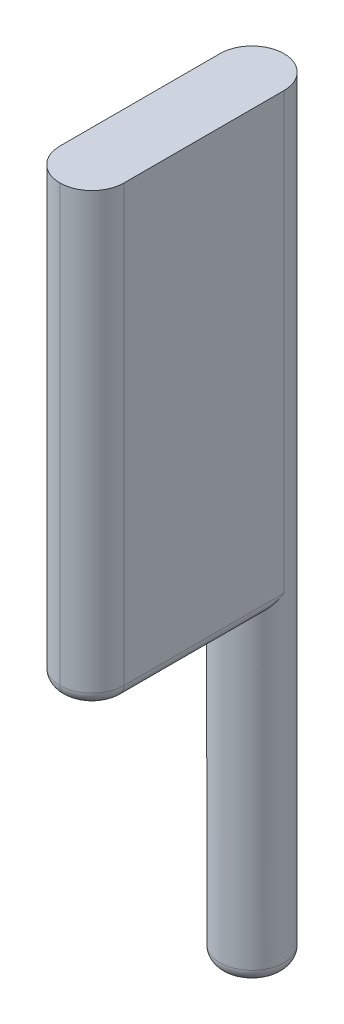
from build123d import *

# Parameters (mm, degrees)
SKETCH1_R           = 5
BOSS_EXTRUDE1_DEPTH = 50
BOSS_EXTRUDE2_DEPTH = 70
FILLET1_R           = 5
FILLET2_R           = 2
FILLET3_R           = 2


# Some blends are built 0.0001 mm under size
with BuildPart() as part:
    # Sketch1 → Boss-Extrude1 (new body)
    with BuildSketch(Plane(origin=(0, 0, 0), x_dir=(1, 0, 0), z_dir=(0, 1, 0))):
        with Locations(Location((0, 0, 0), (0, 0, 270))):
            Circle(SKETCH1_R)
    extrude(amount=BOSS_EXTRUDE1_DEPTH)

    # Sketch2 → Boss-Extrude2 (add)
    with BuildSketch(Plane(origin=(0, 50, 0), x_dir=(1, 0, 0), z_dir=(0, 1, 0))):
        with BuildLine():
            Line((-5, 0), (-5, -30))
            Line((-5, -30), (5, -30))
            Line((5, -30), (5, 0))
            ThreePointArc((5, 0), (0, 5), (-5, 0))
        make_face()
    extrude(amount=BOSS_EXTRUDE2_DEPTH)

    # Fillet1
    fillet1_edges = [part.edges().sort_by_distance(p)[0] for p in [
        (-5, 85, 30),
        (5, 85, 30),
    ]]
    fillet(fillet1_edges, radius=FILLET1_R - 0.0001)  # a hair under: the kernel refuses the full size

    # Fillet2
    # the kernel refuses this fillet: 2 mm, written as the material it takes off along each edge
    with BuildSketch(Plane(origin=(5, 50, 25.0001), x_dir=(-1, 0, 0), z_dir=(0, 0, -1))) as fillet2_piece_1_section:
        with BuildLine():
            CenterArc((FILLET2_R, FILLET2_R), FILLET2_R, 180, 90)
            Line((0, FILLET2_R), (0, 0))
            Line((0, 0), (FILLET2_R, 0))
        make_face()
    fillet2_piece_1 = extrude(amount=30.0001, mode=Mode.PRIVATE)
    fillet2_piece_1 = fillet2_piece_1 - Plane(origin=(0, 50.338854102, 0), x_dir=(0, 0, 1), z_dir=(0, -1, 0)) * Cylinder(5, 69, mode=Mode.PRIVATE)
    add(fillet2_piece_1, mode=Mode.SUBTRACT)
    with BuildSketch(Plane(origin=(0.0001, 50, 25.0001), x_dir=(1, 0, 0), z_dir=(0, 0, -1))) as fillet2_piece_2:
        with BuildLine():
            CenterArc((4.9999 - FILLET2_R, -FILLET2_R), FILLET2_R, 0, 90)
            Line((4.9999, -FILLET2_R), (4.9999, 0))
            Line((4.9999, 0), (4.9999 - FILLET2_R, 0))
        make_face()
    revolve(axis=Axis((0.0001, 50, 25.0001), (0, -1, 0)), revolution_arc=90, mode=Mode.SUBTRACT)
    with BuildSketch(Plane(origin=(-0.0001, 50, 25.0001), x_dir=(0, 0, 1), z_dir=(1, 0, 0))) as fillet2_piece_3:
        with BuildLine():
            CenterArc((4.9999 - FILLET2_R, -FILLET2_R), FILLET2_R, 0, 90)
            Line((4.9999, -FILLET2_R), (4.9999, 0))
            Line((4.9999, 0), (4.9999 - FILLET2_R, 0))
        make_face()
    revolve(axis=Axis((-0.0001, 50, 25.0001), (0, -1, 0)), revolution_arc=90, mode=Mode.SUBTRACT)
    with BuildSketch(Plane(origin=(-5, 50, -5), x_dir=(1, 0, 0), z_dir=(0, 0, 1))) as fillet2_piece_4_section:
        with BuildLine():
            CenterArc((FILLET2_R, FILLET2_R), FILLET2_R, 180, 90)
            Line((0, FILLET2_R), (0, 0))
            Line((0, 0), (FILLET2_R, 0))
        make_face()
    fillet2_piece_4 = extrude(amount=30.0001, mode=Mode.PRIVATE)
    fillet2_piece_4 = fillet2_piece_4 - Plane(origin=(0, 50.465433579, 0), x_dir=(0, 0, 1), z_dir=(0, -1, 0)) * Cylinder(5, 69, mode=Mode.PRIVATE)
    add(fillet2_piece_4, mode=Mode.SUBTRACT)
    with BuildSketch(Plane(origin=(-0.0001, 50, 30), x_dir=(0, 0, -1), z_dir=(1, 0, 0))) as fillet2_piece_5:
        with BuildLine():
            CenterArc((FILLET2_R, FILLET2_R), FILLET2_R, 180, 90)
            Line((0, FILLET2_R), (0, 0))
            Line((0, 0), (FILLET2_R, 0))
        make_face()
    extrude(amount=0.0002, mode=Mode.SUBTRACT)

    # Fillet3
    fillet3_edges = [part.edges().sort_by_distance(p)[0] for p in [
        (0, 0, -5),
    ]]
    fillet(fillet3_edges, radius=FILLET3_R)


solid = part.part
